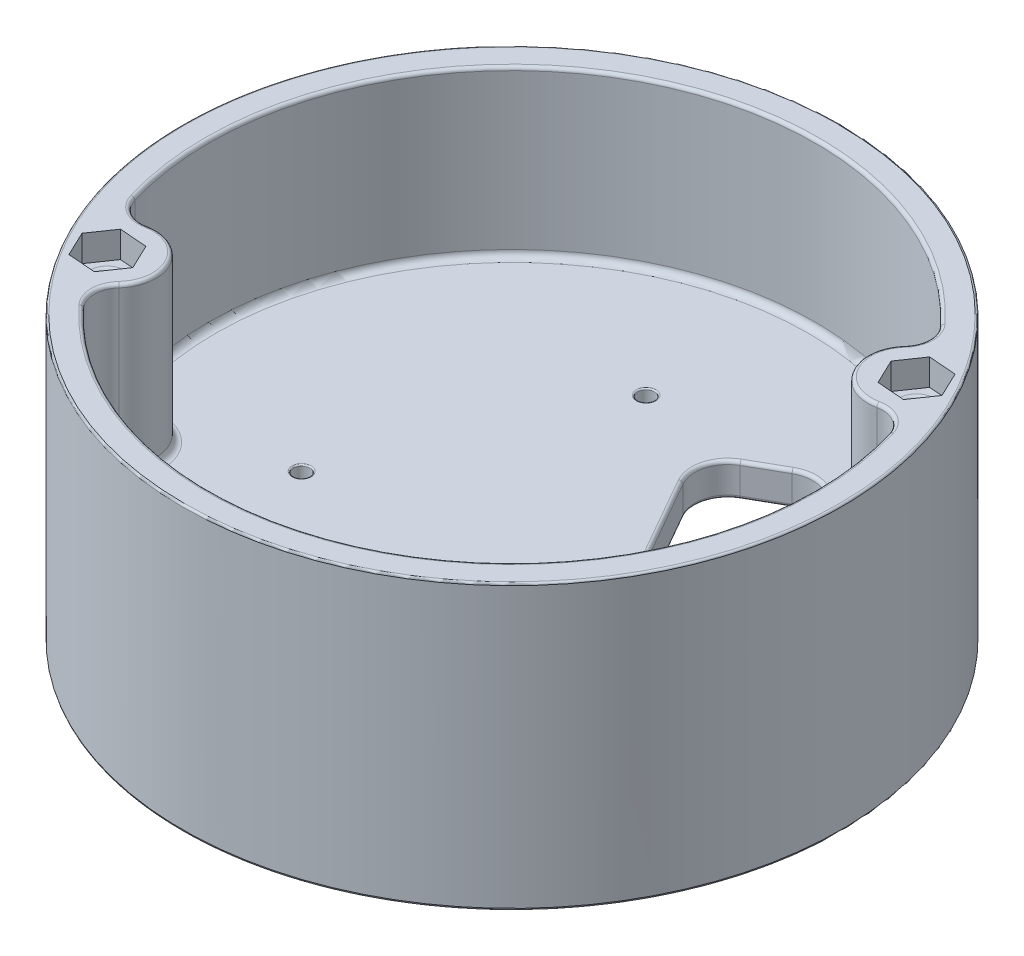
from build123d import *

# Parameters (mm, degrees)
SKETCH1_R           = 50
BOSS_EXTRUDE1_DEPTH = 5
SKETCH3_R           = 1.2499975
SKETCH3_R_2         = 1.277925548
CUT_EXTRUDE2_DEPTH  = 50
SKETCH2_R           = 50
BOSS_EXTRUDE2_DEPTH = 25
SKETCH4_R           = 2.25
CUT_EXTRUDE3_DEPTH  = 77.811457479
CUT_EXTRUDE4_DEPTH  = 4
SKETCH6_R           = 50
SKETCH6_R_2         = 2.25
BOSS_EXTRUDE3_DEPTH = 13
FILLET1_R           = 4
FILLET2_R           = 0.5
FILLET3_R           = 0.8
FILLET4_R           = 0.3
FILLET5_R           = 4
FILLET6_R           = 0.5
FILLET7_R           = 1
FILLET8_R           = 0.5
FILLET9_R           = 0.2


with BuildPart() as part:
    # Sketch1 → Boss-Extrude1 (new body)
    with BuildSketch(Plane(origin=(0, 0, 0), x_dir=(1, 0, 0), z_dir=(0, 1, 0))):
        Circle(SKETCH1_R)
    extrude(amount=BOSS_EXTRUDE1_DEPTH)

    # Sketch3 → Cut-Extrude2 (cut)
    with BuildSketch(Plane(origin=(0, 5, 0), x_dir=(1, 0, 0), z_dir=(0, 1, 0))):
        with Locations((18.99125044, -16.106755454)):
            Circle(SKETCH3_R)
        with Locations((-20.326293221, -11.593084735)):
            Circle(SKETCH3_R)
        with Locations((-4.19491903, 24.545830987)):
            Circle(SKETCH3_R_2)
        with BuildLine():
            Line((9.808943392, 16.129465755), (18.137267372, 1.52731636))
            ThreePointArc((18.137267372, 1.52731636), (21.160987581, -0.818270354), (24.957660917, -0.338757561))
            Line((24.957660917, -0.338757561), (29.977484456, 2.524294694))
            ThreePointArc((29.977484456, 2.524294694), (32.323071171, 5.548014904), (31.843558378, 9.34468824))
            Line((31.843558378, 9.34468824), (23.515234398, 23.946837635))
            ThreePointArc((23.515234398, 23.946837635), (20.491514188, 26.292424349), (16.694840852, 25.812911556))
            Line((16.694840852, 25.812911556), (11.675017313, 22.949859301))
            ThreePointArc((11.675017313, 22.949859301), (9.329430599, 19.926139091), (9.808943392, 16.129465755))
        make_face()
    extrude(amount=-CUT_EXTRUDE2_DEPTH, mode=Mode.SUBTRACT)

    # Sketch2 → Boss-Extrude2 (add)
    with BuildSketch(Plane(origin=(0, 5, 0), x_dir=(1, 0, 0), z_dir=(0, 1, 0))):
        Circle(SKETCH2_R)
        with BuildLine():
            ThreePointArc((-36.781973865, -27.624018509), (22.789870272, -39.957750349), (42.501783745, 17.595407881))
            ThreePointArc((42.501783745, 17.595407881), (33.008576375, 18.826414573), (36.781973865, 27.624018509))
            ThreePointArc((36.781973865, 27.624018509), (-22.789870272, 39.957750349), (-42.501783745, -17.595407881))
            ThreePointArc((-42.501783745, -17.595407881), (-33.008576375, -18.826414573), (-36.781973865, -27.624018509))
        make_face(mode=Mode.SUBTRACT)
    extrude(amount=BOSS_EXTRUDE2_DEPTH)

    # Sketch4 → Cut-Extrude3 (cut, through all)
    with BuildSketch(Plane(origin=(0, 30, 0), x_dir=(1, 0, 0), z_dir=(0, 1, 0))):
        with Locations((39.089103602, 22.29443831)):
            Circle(SKETCH4_R)
        with Locations((-39.089103602, -22.29443831)):
            Circle(SKETCH4_R)
    extrude(amount=-CUT_EXTRUDE3_DEPTH, mode=Mode.SUBTRACT)

    # Sketch5 → Cut-Extrude4 (cut)
    with BuildSketch(Plane(origin=(0, 30, 0), x_dir=(1, 0, 0), z_dir=(0, 1, 0))):
        Polygon((37.27974776, 26.087693038), (34.899370723, 22.62411755), (36.708726566, 18.830862822), (40.898459445, 18.501183582), (43.278836481, 21.96475907), (41.469480639, 25.758013798), align=None)
        Polygon((-40.897304063, -18.503605803), (-43.276161085, -21.96496959), (-41.467960625, -25.755802097), (-37.280903142, -26.085270817), (-34.90204612, -22.62390703), (-36.71024658, -18.833074523), align=None)
    extrude(amount=-CUT_EXTRUDE4_DEPTH, mode=Mode.SUBTRACT)

    # Sketch6 → Boss-Extrude3 (add)
    with BuildSketch(Plane.XZ):
        Circle(SKETCH6_R)
        with Locations((39.089103602, -22.29443831)):
            Circle(SKETCH6_R_2, mode=Mode.SUBTRACT)
        with Locations((-39.089103602, 22.29443831)):
            Circle(SKETCH6_R_2, mode=Mode.SUBTRACT)
        with BuildLine():
            ThreePointArc((-43.281403425, 19.569622316), (-23.533018216, -41.260720469), (38.878101369, -27.289984132))
            ThreePointArc((38.878101369, -27.289984132), (34.745869869, -19.817278498), (43.281403425, -19.569622316))
            ThreePointArc((43.281403425, -19.569622316), (23.533018216, 41.260720469), (-38.878101369, 27.289984132))
            ThreePointArc((-38.878101369, 27.289984132), (-34.745869869, 19.817278498), (-43.281403425, 19.569622316))
        make_face(mode=Mode.SUBTRACT)
    extrude(amount=BOSS_EXTRUDE3_DEPTH)

    # Fillet1
    fillet1_edges = [part.edges().sort_by_distance(p)[0] for p in [
        (43.281403425, -6.5, -19.569622316),
        (38.878101369, -6.5, -27.289984132),
        (-43.281403425, -6.5, 19.569622316),
        (-38.878101369, -6.5, 27.289984132),
    ]]
    fillet(fillet1_edges, radius=FILLET1_R)

    # Fillet2
    fillet2_edges = [part.edges().sort_by_distance(p)[0] for p in [
        (43.248280775, -13, -17.08540319),
        (34.745869869, -13, -19.817278498),
        (36.723044771, -13, -28.526177011),
        (-23.533018216, -13, -41.260720469),
        (-43.248280775, -13, 17.08540319),
        (-34.745869869, -13, 19.817278498),
        (-36.723044771, -13, 28.526177011),
        (23.533018216, -13, 41.260720469),
    ]]
    fillet(fillet2_edges, radius=FILLET2_R)

    # Fillet3
    fillet3_edges = [part.edges().sort_by_distance(p)[0] for p in [
        (43.248280775, 0, -17.08540319),
        (34.745869869, 0, -19.817278498),
        (36.723044771, 0, -28.526177011),
        (-23.533018216, 0, -41.260720469),
        (-43.248280775, 0, 17.08540319),
        (-34.745869869, 0, 19.817278498),
        (-36.723044771, 0, 28.526177011),
        (23.533018216, 0, 41.260720469),
    ]]
    fillet(fillet3_edges, radius=FILLET3_R)

    # Fillet4
    fillet4_edges = [part.edges().sort_by_distance(p)[0] for p in [
        (-50, 30, 0),
        (-50, -13, 0),
    ]]
    fillet(fillet4_edges, radius=FILLET4_R)

    # Fillet5
    fillet5_edges = [part.edges().sort_by_distance(p)[0] for p in [
        (42.501783745, 17.5, -17.595407881),
        (36.781973865, 17.5, -27.624018509),
        (-36.781973865, 17.5, 27.624018509),
        (-42.501783745, 17.5, 17.595407881),
    ]]
    fillet(fillet5_edges, radius=FILLET5_R)

    # Fillet6
    fillet6_edges = [part.edges().sort_by_distance(p)[0] for p in [
        (-34.823793454, 30, 28.54582826),
        (-33.008576375, 30, 18.826414573),
        (-42.298296718, 30, 15.440692872),
        (-22.789870272, 30, -39.957750349),
        (34.823793454, 30, -28.54582826),
        (33.008576375, 30, -18.826414573),
        (42.298296718, 30, -15.440692872),
        (22.789870272, 30, 39.957750349),
        (-41.339103602, 26, 22.29443831),
        (36.839103602, 26, -22.29443831),
    ]]
    fillet(fillet6_edges, radius=FILLET6_R)

    # Fillet7
    fillet7_edges = [part.edges().sort_by_distance(p)[0] for p in [
        (-34.823793454, 5, 28.54582826),
        (-33.008576375, 5, 18.826414573),
        (-42.298296718, 5, 15.440692872),
        (-22.789870272, 5, -39.957750349),
        (34.823793454, 5, -28.54582826),
        (33.008576375, 5, -18.826414573),
        (42.298296718, 5, -15.440692872),
        (22.789870272, 5, 39.957750349),
    ]]
    fillet(fillet7_edges, radius=FILLET7_R)

    # Fillet8
    fillet8_edges = [part.edges().sort_by_distance(p)[0] for p in [
        (32.323071171, 0, -5.548014904),
        (27.467572687, 0, -1.092768567),
        (21.160987581, 0, 0.818270354),
        (13.973105382, 0, -8.828391058),
        (9.329430599, 0, -19.926139091),
        (14.184929083, 0, -24.381385429),
        (20.491514188, 0, -26.292424349),
        (32.323071171, 5, -5.548014904),
        (27.467572687, 5, -1.092768567),
        (21.160987581, 5, 0.818270354),
        (13.973105382, 5, -8.828391058),
        (9.329430599, 5, -19.926139091),
        (14.184929083, 5, -24.381385429),
        (20.491514188, 5, -26.292424349),
        (27.679396388, 0, -16.645762937),
        (27.679396388, 5, -16.645762937),
    ]]
    fillet(fillet8_edges, radius=FILLET8_R)

    # Fillet9
    fillet9_edges = [part.edges().sort_by_distance(p)[0] for p in [
        (-5.472844578, 0, -24.545830987),
        (-5.472844578, 5, -24.545830987),
        (-21.576290721, 0, 11.593084735),
        (-21.576290721, 5, 11.593084735),
        (17.74125294, 0, 16.106755454),
        (17.74125294, 5, 16.106755454),
    ]]
    fillet(fillet9_edges, radius=FILLET9_R)


solid = part.part
